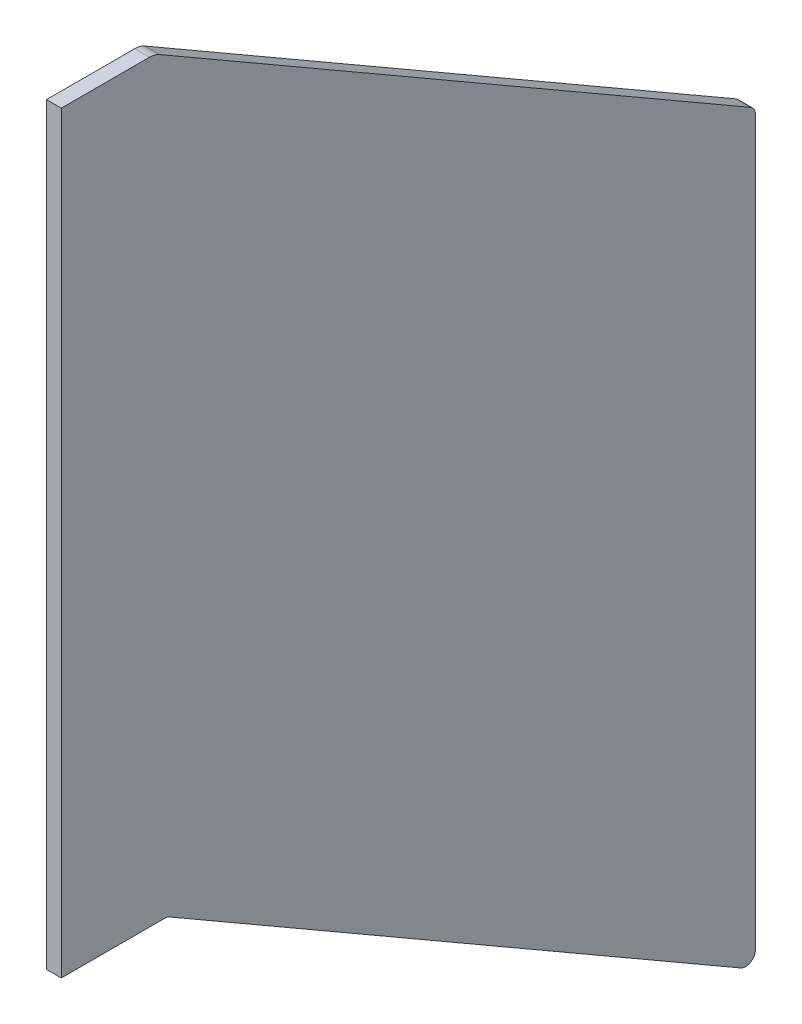
from build123d import *

# Parameters (mm, degrees)
SM_BASE_FLANGE_1_DEPTH = 1.5


# Sheet-metal steps are written as plain solids
with BuildPart() as part:
    # Sketch 1 → Базовая кромка1 (new body)
    with BuildSketch(Plane(origin=(0, 0, 0), x_dir=(0, 0, -1), z_dir=(1, 0, 0))):
        with BuildLine():
            Line((0, 0), (10.5, 0))
            ThreePointArc((10.5, 0), (10.758819045, -0.034074174), (11, -0.133974596))
            Line((11, -0.133974596), (69, -33.620290209))
            ThreePointArc((69, -33.620290209), (70, -33.620290209), (70.5, -32.754264805))
            Line((70.5, -32.754264805), (70.5, 40.70428331))
            ThreePointArc((70.5, 40.70428331), (70.366025404, 41.20428331), (70, 41.570308714))
            Line((70, 41.570308714), (9.964101615, 76.232050808))
            ThreePointArc((9.964101615, 76.232050808), (9.481739705, 76.431851653), (8.964101615, 76.5))
            Line((8.964101615, 76.5), (0, 76.5))
            Line((0, 76.5), (0, 0))
        make_face()
    extrude(amount=-SM_BASE_FLANGE_1_DEPTH)


solid = part.part
